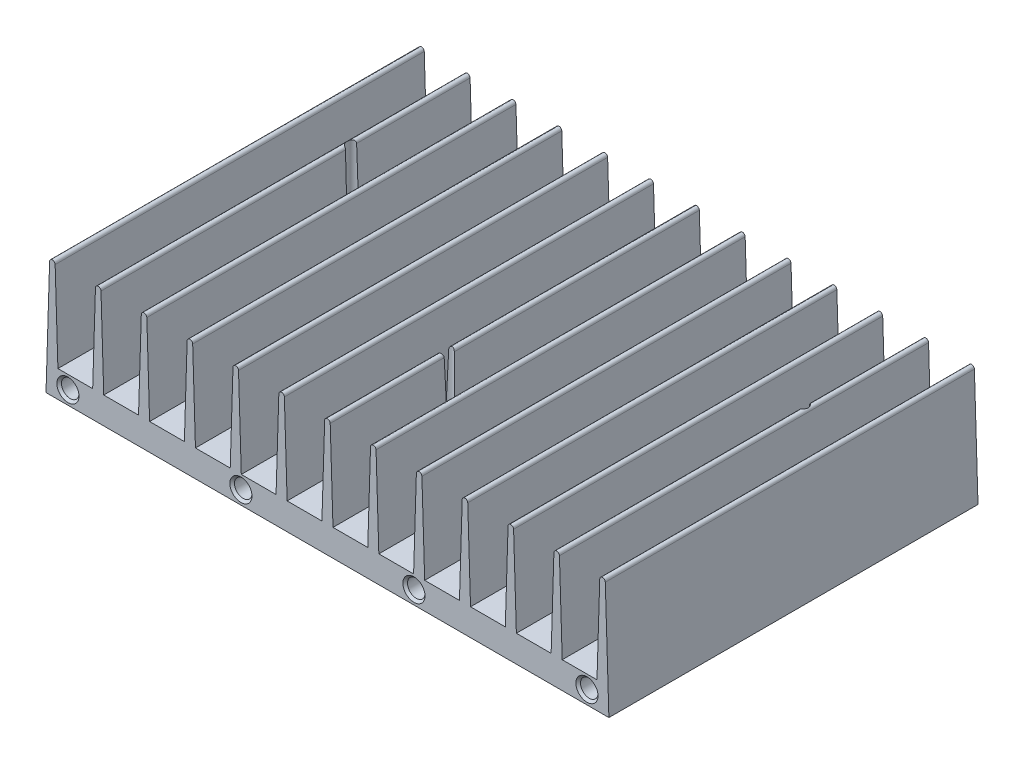
from build123d import *

# Parameters (mm, degrees)
BOSS_EXTRUDE1_DEPTH     = 40
SKETCH2_R               = 1.9
CUT_EXTRUDE1_DEPTH      = 15
CHAMFER1_SIZE           = 0.5
CUT_EXTRUDE2_DEPTH      = 78.307017581
CUT_EXTRUDE2_DEPTH_BACK = 78.307017581
SKETCH3_R               = 1.25
SKETCH5_R               = 1.9
CUT_EXTRUDE3_DEPTH      = 15
CHAMFER2_SIZE           = 0.5


with BuildPart() as part:
    # Sketch1 → Boss-Extrude1 (new, symmetric)
    with BuildSketch(Plane.XY):
        with BuildLine():
            Line((-61, 0), (61, 0))
            Line((61, 0), (60.218926657, 25.018731725))
            ThreePointArc((60.218926657, 25.018731725), (59.618926657, 25.600292327), (59.018926657, 25.018731725))
            Line((59.018926657, 25.018731725), (58.418926657, 5.8))
            Line((58.418926657, 5.8), (50.882438881, 5.8))
            Line((50.882438881, 5.8), (50.282438881, 25.018731725))
            ThreePointArc((50.282438881, 25.018731725), (49.682438881, 25.600292327), (49.082438881, 25.018731725))
            Line((49.082438881, 25.018731725), (48.482438881, 5.8))
            Line((48.482438881, 5.8), (40.945951105, 5.8))
            Line((40.945951105, 5.8), (40.345951105, 25.018731725))
            ThreePointArc((40.345951105, 25.018731725), (39.745951105, 25.600292327), (39.145951105, 25.018731725))
            Line((39.145951105, 25.018731725), (38.545951105, 5.8))
            Line((38.545951105, 5.8), (31.009463329, 5.8))
            Line((31.009463329, 5.8), (30.409463329, 25.018731725))
            ThreePointArc((30.409463329, 25.018731725), (29.809463329, 25.600292327), (29.209463329, 25.018731725))
            Line((29.209463329, 25.018731725), (28.609463329, 5.8))
            Line((28.609463329, 5.8), (21.072975552, 5.8))
            Line((21.072975552, 5.8), (20.472975552, 25.018731725))
            ThreePointArc((20.472975552, 25.018731725), (19.872975552, 25.600292327), (19.272975552, 25.018731725))
            Line((19.272975552, 25.018731725), (18.672975552, 5.8))
            Line((18.672975552, 5.8), (11.136487776, 5.8))
            Line((11.136487776, 5.8), (10.536487776, 25.018731725))
            ThreePointArc((10.536487776, 25.018731725), (9.936487776, 25.600292327), (9.336487776, 25.018731725))
            Line((9.336487776, 25.018731725), (8.736487776, 5.8))
            Line((8.736487776, 5.8), (1.2, 5.8))
            Line((1.2, 5.8), (0.6, 25.018731725))
            ThreePointArc((0.6, 25.018731725), (0, 25.600292327), (-0.6, 25.018731725))
            Line((-0.6, 25.018731725), (-1.2, 5.8))
            Line((-1.2, 5.8), (-8.736487776, 5.8))
            Line((-8.736487776, 5.8), (-9.336487776, 25.018731725))
            ThreePointArc((-9.336487776, 25.018731725), (-9.936487776, 25.600292327), (-10.536487776, 25.018731725))
            Line((-10.536487776, 25.018731725), (-11.136487776, 5.8))
            Line((-11.136487776, 5.8), (-18.672975552, 5.8))
            Line((-18.672975552, 5.8), (-19.272975552, 25.018731725))
            ThreePointArc((-19.272975552, 25.018731725), (-19.872975552, 25.600292327), (-20.472975552, 25.018731725))
            Line((-20.472975552, 25.018731725), (-21.072975552, 5.8))
            Line((-21.072975552, 5.8), (-28.609463329, 5.8))
            Line((-28.609463329, 5.8), (-29.209463329, 25.018731725))
            ThreePointArc((-29.209463329, 25.018731725), (-29.809463329, 25.600292327), (-30.409463329, 25.018731725))
            Line((-30.409463329, 25.018731725), (-31.009463329, 5.8))
            Line((-31.009463329, 5.8), (-38.545951105, 5.8))
            Line((-38.545951105, 5.8), (-39.145951105, 25.018731725))
            ThreePointArc((-39.145951105, 25.018731725), (-39.745951105, 25.600292327), (-40.345951105, 25.018731725))
            Line((-40.345951105, 25.018731725), (-40.945951105, 5.8))
            Line((-40.945951105, 5.8), (-48.482438881, 5.8))
            Line((-48.482438881, 5.8), (-49.082438881, 25.018731725))
            ThreePointArc((-49.082438881, 25.018731725), (-49.682438881, 25.600292327), (-50.282438881, 25.018731725))
            Line((-50.282438881, 25.018731725), (-50.882438881, 5.8))
            Line((-50.882438881, 5.8), (-58.418926657, 5.8))
            Line((-58.418926657, 5.8), (-59.018926657, 25.018731725))
            ThreePointArc((-59.018926657, 25.018731725), (-59.618926657, 25.600292327), (-60.218926657, 25.018731725))
            Line((-60.218926657, 25.018731725), (-61, 0))
        make_face()
    extrude(amount=BOSS_EXTRUDE1_DEPTH, both=True)

    # Sketch2 → Cut-Extrude1 (cut)
    with BuildSketch(Plane.XY.offset(40)):
        with Locations((-18.75, 2.9)):
            Circle(SKETCH2_R)
        with Locations((-56.25, 2.9)):
            Circle(SKETCH2_R)
        with Locations((56.25, 2.9)):
            Circle(SKETCH2_R)
        with Locations((18.75, 2.9)):
            Circle(SKETCH2_R)
    extrude(amount=-CUT_EXTRUDE1_DEPTH, mode=Mode.SUBTRACT)

    # Chamfer1
    chamfer1_edges = [part.edges().sort_by_distance(p)[0] for p in [
        (54.35, 2.9, 40),
        (16.85, 2.9, 40),
        (-20.65, 2.9, 40),
        (-58.15, 2.9, 40),
    ]]
    chamfer(chamfer1_edges, length=CHAMFER1_SIZE)

    # Sketch3 → Cut-Extrude2 (cut, two sides: drawn at the far end of the back side and taken through both)
    with BuildSketch(Plane.XZ.offset(-CUT_EXTRUDE2_DEPTH_BACK)):
        with Locations((-48.75, -14.2)):
            Circle(SKETCH3_R)
        with Locations((48.75, -14.2)):
            Circle(SKETCH3_R)
        with Locations((-16.25, -14.2)):
            Circle(SKETCH3_R)
        with Locations((16.25, -14.2)):
            Circle(SKETCH3_R)
        with Locations((-32.5, 14.2)):
            Circle(SKETCH3_R)
        with Locations((0, 14.2)):
            Circle(SKETCH3_R)
        with Locations((32.5, 14.2)):
            Circle(SKETCH3_R)
    extrude(amount=CUT_EXTRUDE2_DEPTH + CUT_EXTRUDE2_DEPTH_BACK, mode=Mode.SUBTRACT)

    # Sketch5 → Cut-Extrude3 (cut)
    with BuildSketch(Plane(origin=(0, 0, -40), x_dir=(-1, 0, 0), z_dir=(0, 0, -1))):
        with Locations((-37.5, 2.9)):
            Circle(SKETCH5_R)
        with Locations((0, 2.9)):
            Circle(SKETCH5_R)
        with Locations((37.5, 2.9)):
            Circle(SKETCH5_R)
    extrude(amount=-CUT_EXTRUDE3_DEPTH, mode=Mode.SUBTRACT)

    # Chamfer2
    chamfer2_edges = [part.edges().sort_by_distance(p)[0] for p in [
        (-35.6, 2.9, -40),
        (1.9, 2.9, -40),
        (39.4, 2.9, -40),
    ]]
    chamfer(chamfer2_edges, length=CHAMFER2_SIZE)


solid = part.part
